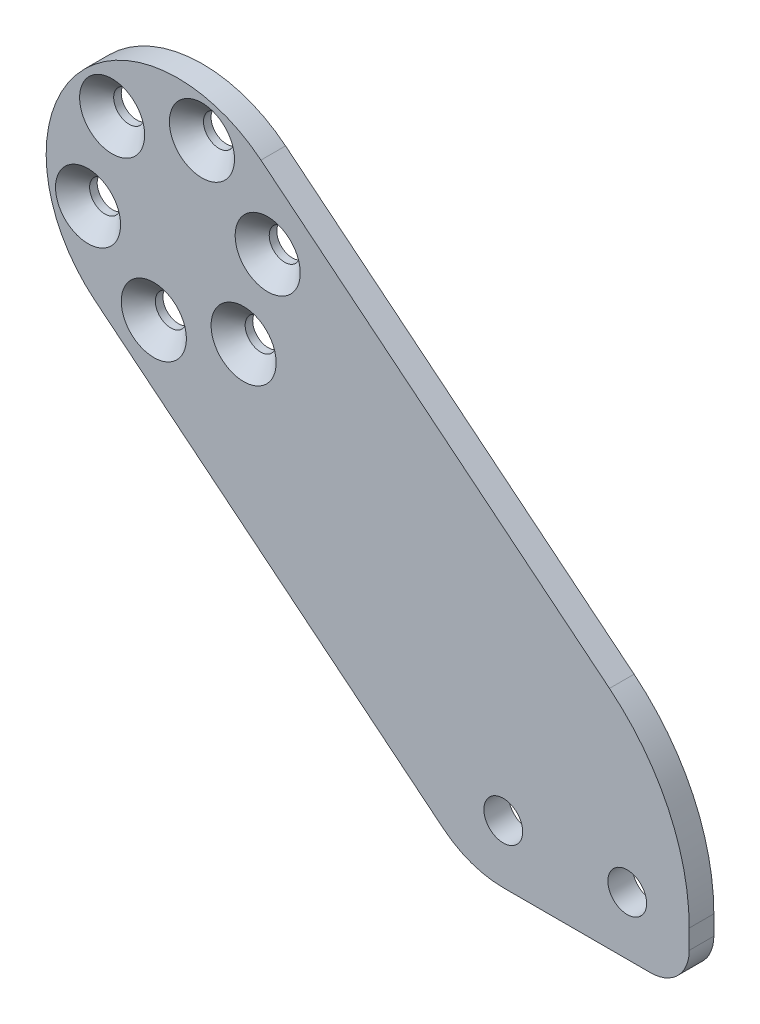
from build123d import *

# Parameters (mm, degrees)
SKETCH1_R           = 2
SKETCH1_R_2         = 2.5
BOSS_EXTRUDE1_DEPTH = 3.175
FILLET1_R           = 5
CHAMFER1_SIZE       = 2.2


with BuildPart() as part:
    # Sketch1 → Boss-Extrude1 (new body)
    with BuildSketch(Plane.XY):
        with BuildLine():
            Line((34.261326859, -49.751843123), (-10.721932331, -13.1924284))
            ThreePointArc((-10.721932331, -13.1924284), (-13.1924284, 10.721932331), (10.721932331, 13.1924284))
            Line((10.721932331, 13.1924284), (55.705191521, -23.366986323))
            ThreePointArc((55.705191521, -23.366986323), (63.295065064, -33.021160716), (66, -45))
            Line((66, -45), (66, -52.5))
            Line((66, -52.5), (42, -52.5))
            ThreePointArc((42, -52.5), (37.893924373, -51.792566974), (34.261326859, -49.751843123))
        make_face()
        with Locations((-8.485281374, 8.485281374)):
            Circle(SKETCH1_R, mode=Mode.SUBTRACT)
        with Locations((3.105828541, 11.591109915)):
            Circle(SKETCH1_R, mode=Mode.SUBTRACT)
        with Locations((11.591109915, 3.105828541)):
            Circle(SKETCH1_R, mode=Mode.SUBTRACT)
        with Locations((8.485281374, -8.485281374)):
            Circle(SKETCH1_R, mode=Mode.SUBTRACT)
        with Locations((42, -45)):
            Circle(SKETCH1_R_2, mode=Mode.SUBTRACT)
        with Locations((58, -45)):
            Circle(SKETCH1_R_2, mode=Mode.SUBTRACT)
        with Locations((-3.105828541, -11.591109915)):
            Circle(SKETCH1_R, mode=Mode.SUBTRACT)
        with Locations((-11.591109915, -3.105828541)):
            Circle(SKETCH1_R, mode=Mode.SUBTRACT)
    extrude(amount=BOSS_EXTRUDE1_DEPTH)

    # Fillet1
    fillet1_edges = [part.edges().sort_by_distance(p)[0] for p in [
        (66, -52.5, 1.5875),
    ]]
    fillet(fillet1_edges, radius=FILLET1_R)

    # Chamfer1
    chamfer1_edges = [part.edges().sort_by_distance(p)[0] for p in [
        (6.485281374, -8.485281374, 3.175),
        (-5.105828541, -11.591109915, 3.175),
        (-13.591109915, -3.105828541, 3.175),
        (-10.485281374, 8.485281374, 3.175),
        (9.591109915, 3.105828541, 3.175),
        (1.105828541, 11.591109915, 3.175),
    ]]
    chamfer(chamfer1_edges, length=CHAMFER1_SIZE)


solid = part.part
